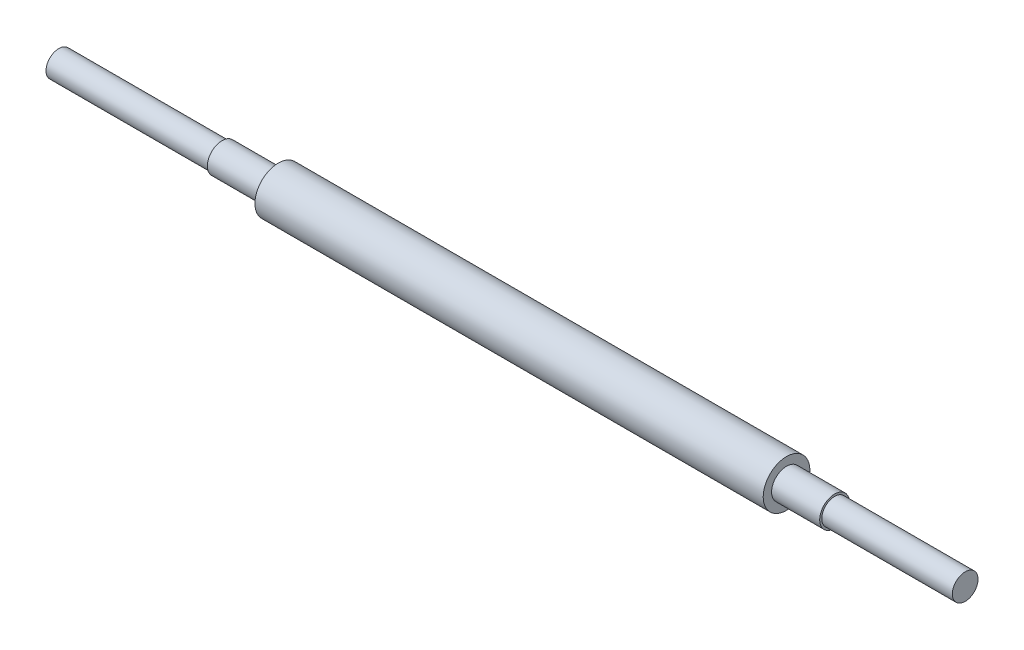
from build123d import *


with BuildPart() as part:
    # Sketch1 → Revolve1 (revolve)
    with BuildSketch(Plane(origin=(0, 0, 0), x_dir=(1, 0, 0), z_dir=(0, 1, 0))):
        Polygon((-78.63058905, 0), (-78.63058905, 3.499993), (-34.18058905, 3.499993), (-34.18058905, 4), (-18.88146905, 4), (-18.88146905, 6.35), (119.54853095, 6.35), (119.54853095, 4.064), (132.648530912, 4.064), (132.648530912, 3.499993), (168.208530912, 3.499993), (168.208530912, 0), align=None)
    revolve(axis=Axis((-97.950567047, 0, 0), (1, 0, 0)))


solid = part.part
